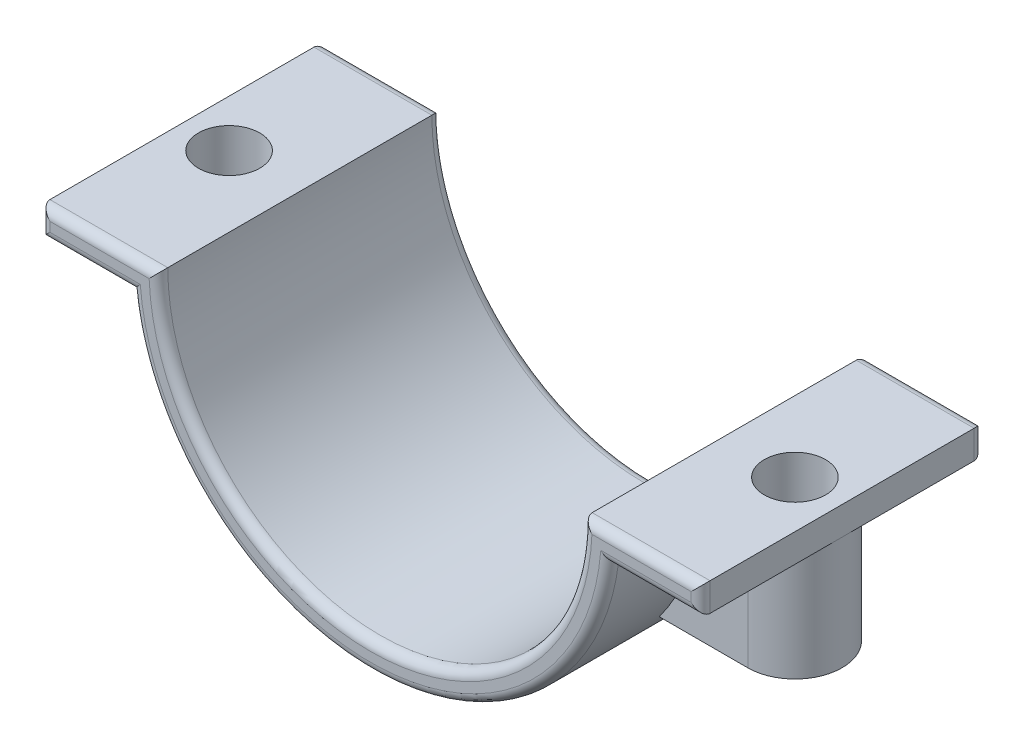
from build123d import *

# Parameters (mm, degrees)
BOSS_EXTRUDE1_DEPTH = 15
BOSS_EXTRUDE2_REACH = 58.23
BOSS_EXTRUDE2_START = 12
SKETCH2_3_R         = 3.25
CUT_EXTRUDE1_DEPTH  = 45.229515032
FILLET1_R           = 1


with BuildPart() as part:
    # Sketch1 → Boss-Extrude1 (new, symmetric)
    with BuildSketch(Plane.XY):
        with BuildLine():
            Line((-35, 0), (-22.5, 0))
            ThreePointArc((-22.5, 0), (0, -22.5), (22.5, 0))
            Line((22.5, 0), (35, 0))
            Line((35, 0), (35, -3))
            Line((35, -3), (25.322914524, -3))
            ThreePointArc((25.322914524, -3), (0, -25.5), (-25.322914524, -3))
            Line((-25.322914524, -3), (-35, -3))
            Line((-35, -3), (-35, 0))
        make_face()
    extrude(amount=BOSS_EXTRUDE1_DEPTH, both=True)

    # Sketch2 → Boss-Extrude2 (add, up to next)
    with BuildSketch(Plane.XZ.offset(3).offset(BOSS_EXTRUDE2_START), mode=Mode.PRIVATE) as boss_extrude2_sk1:
        with BuildLine():
            Line((18, 5), (18, -5))
            Line((18, -5), (30, -5))
            ThreePointArc((30, -5), (35, 0), (30, 5))
            Line((30, 5), (18, 5))
        make_face()
    boss_extrude2_tool1 = extrude(boss_extrude2_sk1.sketch, amount=-BOSS_EXTRUDE2_REACH, mode=Mode.PRIVATE) - part.part
    boss_extrude2 = boss_extrude2_tool1.solids().sort_by_distance((26.002593, -15, 0))[0]
    add(boss_extrude2)

    # Sketch2<3> → Cut-Extrude1 (cut, symmetric)
    with BuildSketch(Plane.XZ.offset(3)):
        with Locations((30, 0)):
            Circle(SKETCH2_3_R)
    cut_extrude1 = extrude(amount=CUT_EXTRUDE1_DEPTH, both=True, mode=Mode.SUBTRACT)

    # Mirror1: Boss-Extrude2, Cut-Extrude1 across plane
    add(boss_extrude2.mirror(Plane(origin=(0, 0, 0), x_dir=(0, 0, 1), z_dir=(1, 0, 0))))
    add(cut_extrude1.mirror(Plane(origin=(0, 0, 0), x_dir=(0, 0, 1), z_dir=(1, 0, 0))), mode=Mode.SUBTRACT)

    # Fillet1
    fillet1_edges = [part.edges().sort_by_distance(p)[0] for p in [
        (28.75, 0, 15),
        (35, -1.5, 15),
        (30.161457262, -3, 15),
        (0, -25.5, 15),
        (-30.161457262, -3, 15),
        (-35, -1.5, 15),
        (-28.75, 0, 15),
        (0, -22.5, 15),
        (-28.75, 0, -15),
        (-35, -1.5, -15),
        (-30.161457262, -3, -15),
        (0, -25.5, -15),
        (30.161457262, -3, -15),
        (35, -1.5, -15),
        (28.75, 0, -15),
        (0, -22.5, -15),
    ]]
    fillet(fillet1_edges, radius=FILLET1_R)


solid = part.part
